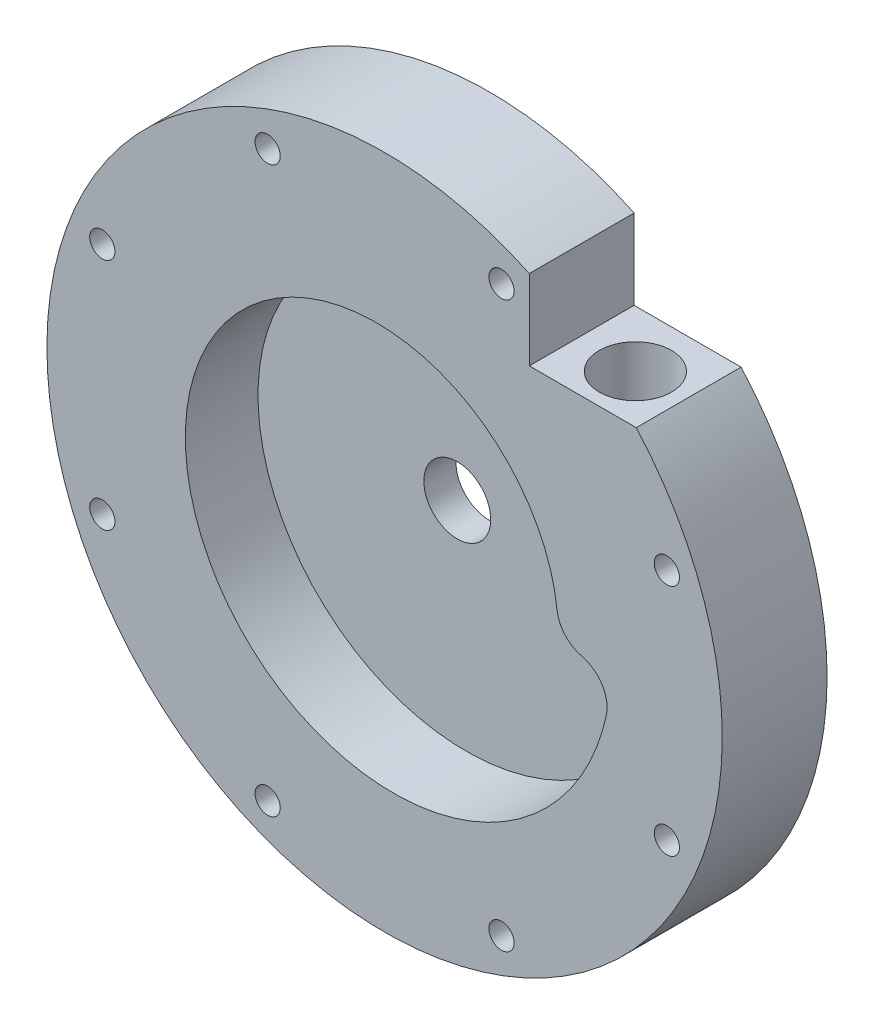
from build123d import *

# Parameters (mm, degrees)
VOLUTE_CUT_DEPTH                  = 96.378521959
SKETCH28_W                        = 21.1216108
SKETCH28_H                        = 15.791389426
OUTLET_HOLE_CUT_DEPTH             = 97.53829643
OUTLET_HOLE_D                     = 9.525
OUTLET_HOLE_DEPTH                 = 48.26
OUTLET_HOLE_TIP                   = 2.861598698
PIPE_TAP_DRILL_FOR_3_8_TAP1_D     = 14.2748
PIPE_TAP_DRILL_FOR_3_8_TAP1_DEPTH = 14.2875
PIPE_TAP_DRILL_FOR_3_8_TAP1_TIP   = 4.288582582
F_10_CLEARANCE_HOLE1_D            = 4.9784
CIRPATTERN1_COUNT                 = 8


with BuildPart() as part:
    # Sketch22 → Main Body (revolve)
    with BuildSketch(Plane(origin=(0, 0, 0), x_dir=(1, 0, 0), z_dir=(0, 1, 0))):
        Polygon((-25.4, 0), (-6.604, 0), (-6.604, 6.35), (-11.1125, 6.35), (-11.1125, 4.7625), (-17.4625, 4.7625), (-17.4625, 6.35), (-66.675, 6.35), (-66.675, -14.351), (-25.4, -14.351), align=None)
    revolve(axis=Axis((0, 0, 0), (0, 0, -1)))

    # Sketch23 → Volute Cut (cut, through all)
    with BuildSketch(Plane.XY):
        with BuildLine():
            add(Edge.make_bspline(
                [(34.064510192, 5.454106486), (33.999925559, 6.012567004), (33.840921955, 7.145016481), (33.51671457, 8.840379872), (33.102704602, 10.538150267), (32.602833338, 12.216692386), (32.017965922, 13.871662747), (31.349191468, 15.498755899), (30.5978199, 17.093716034), (29.765379241, 18.652348338), (28.85361226, 20.170530201), (27.864472781, 21.644222235), (26.800121479, 23.069479109), (25.662921186, 24.442460162), (24.455431695, 25.759439779), (23.180404062, 27.016817518), (21.840774402, 28.21112794), (20.439657201, 29.339050137), (18.980338149, 30.397416931), (17.466266506, 31.383223709), (15.90104702, 32.293636882), (14.288431416, 33.126001944), (12.632309463, 33.877851098), (10.936699661, 34.546910451), (9.205739549, 35.131106723), (7.443675663, 35.628573491), (5.654853178, 36.037656917), (3.84370524, 36.356920959), (2.014742036, 36.585152051), (0.172539606, 36.721363228), (-1.678271559, 36.764797689), (-3.533018111, 36.714931787), (-5.3869956, 36.571477434), (-7.235480366, 36.334383913), (-9.07374153, 36.003839086), (-10.897053062, 35.58027), (-12.700705888, 35.064342878), (-14.480020006, 34.456962497), (-16.230356593, 33.759270957), (-17.947130045, 32.972645827), (-19.625819949, 32.098697681), (-21.261982935, 31.139267032), (-22.851264382, 30.096420656), (-24.389409957, 28.972447316), (-25.872276938, 27.769852906), (-27.29584531, 26.491355013), (-28.656228591, 25.139876909), (-29.949684369, 23.718540989), (-31.17262451, 22.230661674), (-32.32162502, 20.679737787), (-33.393435533, 19.069444419), (-34.384988385, 17.40362431), (-35.293407272, 15.686278765), (-36.11601545, 13.921558115), (-36.850343459, 12.113751764), (-37.494136352, 10.267277823), (-38.045360401, 8.38667238), (-38.502209273, 6.476578416), (-38.863109645, 4.541734393), (-39.126726243, 2.586962555), (-39.291966303, 0.617156959), (-39.357983419, -1.362728731), (-39.324180782, -3.347693652), (-39.190213789, -5.332702333), (-38.955992027, -7.312697422), (-38.621680597, -9.282612528), (-38.187700803, -11.23738514), (-37.654730183, -13.171969596), (-37.023701879, -15.081350059), (-36.295803353, -16.960553479), (-35.472474446, -18.804662496), (-34.555404779, -20.608828259), (-33.546530503, -22.368283123), (-32.448030404, -24.078353194), (-31.26232137, -25.734470685), (-29.992053224, -27.332186055), (-28.640102943, -28.867179894), (-27.209568266, -30.335274533), (-25.70376071, -31.732445327), (-24.12619801, -33.054831606), (-22.480595995, -34.298747245), (-20.770859922, -35.460690836), (-19.001075294, -36.537355425), (-17.175498164, -37.525637795), (-15.298544973, -38.422647266), (-13.374781932, -39.225713982), (-11.408913967, -39.93239668), (-9.405773269, -40.540489886), (-7.370307471, -41.048030557), (-5.307567475, -41.453304115), (-3.222694963, -41.754849874), (-1.120909625, -41.951465843), (0.992503863, -42.042212881), (3.11220909, -42.026418195), (5.232831344, -41.903678173), (7.348971199, -41.673860539), (9.455218223, -41.337105816), (11.546164776, -40.893828104), (13.616419848, -40.344715153), (15.660622923, -39.690727741), (17.673457812, -38.93309834), (19.649666438, -38.073329092), (21.584062524, -37.113189077), (23.471545152, -36.054710891), (25.307112165, -34.900186527), (27.085873367, -33.652162581), (28.803063488, -32.313434789), (30.454054887, -30.887041888), (32.034369952, -29.376258848), (33.539693165, -27.784589454), (34.9658828, -26.115758288), (36.30898223, -24.373702093), (37.565230795, -22.562560578), (38.731074224, -20.686666652), (39.803174556, -18.750536124), (40.778419563, -16.758856904), (41.653931621, -14.716477704), (42.427076016, -12.628396291), (43.09546867, -10.499747309), (43.525419873, -8.842806932), (43.737764823, -7.898560044), (43.785018459, -7.680797519)],
                knots=[0.02206466, 0.02206466, 0.02206466, 0.02206466, 0.028876067, 0.0359159, 0.042971309, 0.050042349, 0.057129073, 0.064231529, 0.071349764, 0.078483823, 0.085633747, 0.092799578, 0.099981356, 0.107179117, 0.1143929, 0.121622741, 0.128868673, 0.136130732, 0.14340895, 0.15070336, 0.158013994, 0.165340883, 0.172684057, 0.180043546, 0.18741938, 0.194811587, 0.202220196, 0.209645235, 0.217086731, 0.224544712, 0.232019203, 0.239510231, 0.247017823, 0.254542004, 0.262082798, 0.269640231, 0.277214328, 0.284805113, 0.29241261, 0.300036843, 0.307677836, 0.31533561, 0.323010191, 0.3307016, 0.338409861, 0.346134995, 0.353877025, 0.361635972, 0.369411859, 0.377204707, 0.385014537, 0.392841372, 0.40068523, 0.408546135, 0.416424105, 0.424319163, 0.432231327, 0.440160619, 0.448107058, 0.456070665, 0.464051459, 0.47204946, 0.480064687, 0.48809716, 0.496146898, 0.50421392, 0.512298245, 0.520399892, 0.52851888, 0.536655227, 0.544808952, 0.552980073, 0.561168609, 0.569374578, 0.577597998, 0.585838887, 0.594097262, 0.602373142, 0.610666545, 0.618977488, 0.627305988, 0.635652063, 0.64401573, 0.652397007, 0.66079591, 0.669212457, 0.677646665, 0.686098551, 0.694568131, 0.703055422, 0.711560441, 0.720083205, 0.728623729, 0.737182031, 0.745758127, 0.754352033, 0.762963766, 0.771593341, 0.780240774, 0.788906083, 0.797589282, 0.806290387, 0.815009415, 0.823746381, 0.8325013, 0.841274189, 0.850065063, 0.858873938, 0.867700829, 0.876545751, 0.885408719, 0.89428975, 0.903188858, 0.912106059, 0.921041367, 0.929994798, 0.938966366, 0.947956087, 0.956963975, 0.965990046, 0.968689861, 0.968689861, 0.968689861, 0.968689861], degree=3))
            ThreePointArc((43.785018459, -7.680797519), (42.929741497, -2.845728613), (38.928339408, 0))
            ThreePointArc((38.928339408, 0), (35.633213775, 1.957264275), (34.064510192, 5.454106486))
        make_face()
    extrude(amount=VOLUTE_CUT_DEPTH, mode=Mode.SUBTRACT)

    # Sketch28 → Outlet Hole Cut (cut, through all)
    with BuildSketch(Plane.XY.offset(14.351)):
        with Locations((39.1358054, 52.345694713)):
            Rectangle(SKETCH28_W, SKETCH28_H)
    extrude(amount=-OUTLET_HOLE_CUT_DEPTH, mode=Mode.SUBTRACT)

    # Outlet Hole
    with Locations(Plane(origin=(39.965, 44.45, 4.79815), x_dir=(0, 0, 1), z_dir=(0, 1, 0))):
        with Locations((0, 0)):
            Hole(OUTLET_HOLE_D / 2, depth=OUTLET_HOLE_DEPTH)
            with Locations((0, 0, -(OUTLET_HOLE_DEPTH + OUTLET_HOLE_TIP / 2))):  # 118° drill point
                Cone(0, OUTLET_HOLE_D / 2, OUTLET_HOLE_TIP, mode=Mode.SUBTRACT)

    # Pipe Tap Drill for 3/8 Tap1
    with Locations(Plane(origin=(39.965, 44.45, 4.79815), x_dir=(0, 0, 1), z_dir=(0, 1, 0))):
        with Locations((0, 0)):
            Hole(PIPE_TAP_DRILL_FOR_3_8_TAP1_D / 2, depth=PIPE_TAP_DRILL_FOR_3_8_TAP1_DEPTH)
            with Locations((0, 0, -(PIPE_TAP_DRILL_FOR_3_8_TAP1_DEPTH + PIPE_TAP_DRILL_FOR_3_8_TAP1_TIP / 2))):  # 118° drill point
                Cone(0, PIPE_TAP_DRILL_FOR_3_8_TAP1_D / 2, PIPE_TAP_DRILL_FOR_3_8_TAP1_TIP, mode=Mode.SUBTRACT)

    # #10 Clearance Hole1 (through all)
    with Locations(Plane(origin=(55.733032799, -23.085378057, 14.351), x_dir=(1, 0, 0), z_dir=(0, 0, 1))):
        with Locations((0, 0)):
            f_10_clearance_hole1 = Hole(F_10_CLEARANCE_HOLE1_D / 2)

    # CirPattern1: #10 Clearance Hole1 ×8 about axis
    cirpattern1_axis = Axis((0, 0, 0), (0, 0, 1))
    for i in range(1, CIRPATTERN1_COUNT):
        add(f_10_clearance_hole1.rotate(cirpattern1_axis, i * 360 / CIRPATTERN1_COUNT), mode=Mode.SUBTRACT)


solid = part.part
